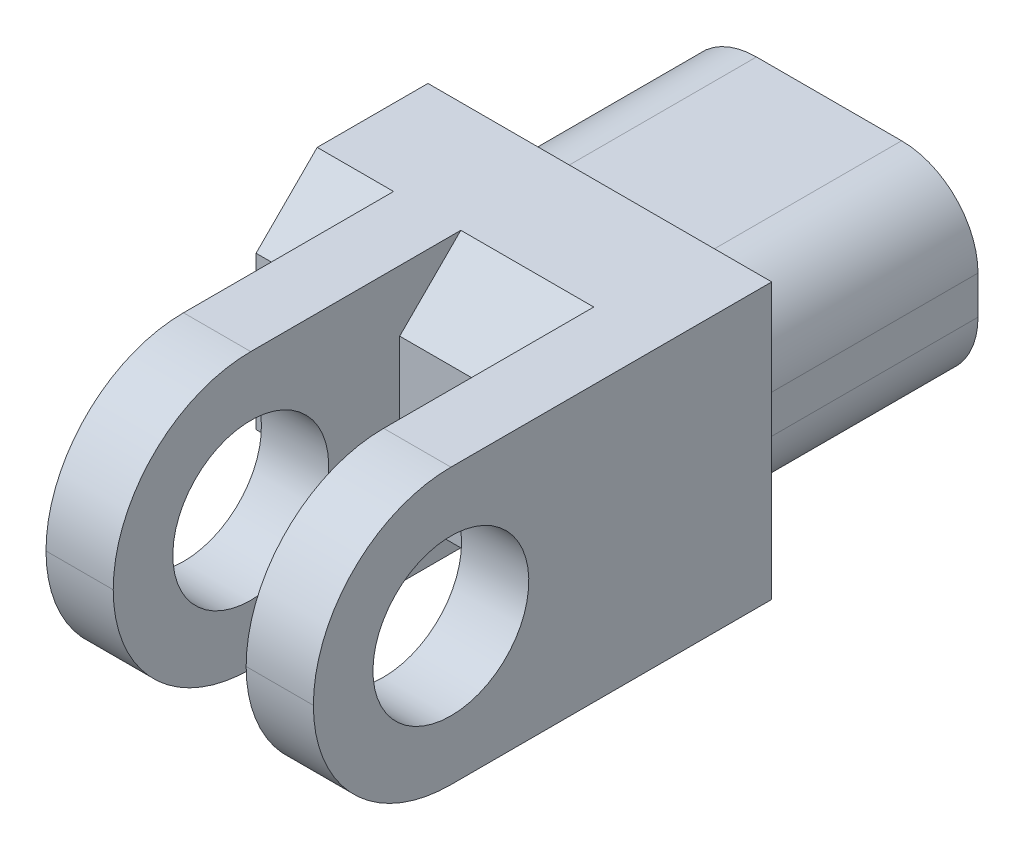
from build123d import *

# Parameters (mm, degrees)
SKETCH2_W           = 24.765
SKETCH2_H           = 15.875
BOSS_EXTRUDE1_DEPTH = 19.05
SKETCH3_W           = 28.575
SKETCH3_H           = 22.86
BOSS_EXTRUDE2_DEPTH = 38.1
SKETCH4_W           = 6.35
SKETCH4_H           = 23.8125
SKETCH4_W_2         = 11.049
CUT_EXTRUDE1_DEPTH  = 47.6725
FILLET5_R           = 11.43
SKETCH7_R           = 6.477
CUT_EXTRUDE3_DEPTH  = 46.56539833
FILLET3_R           = 6.35
CHAMFER1_SIZE       = 5.08


with BuildPart() as part:
    # Sketch2 → Boss-Extrude1 (new body)
    with BuildSketch(Plane.XY):
        Rectangle(SKETCH2_W, SKETCH2_H)
    extrude(amount=-BOSS_EXTRUDE1_DEPTH)

    # Sketch3 → Boss-Extrude2 (add)
    with BuildSketch(Plane.XY):
        Rectangle(SKETCH3_W, SKETCH3_H)
    extrude(amount=BOSS_EXTRUDE2_DEPTH)

    # Sketch4 → Cut-Extrude1 (cut, through all)
    with BuildSketch(Plane(origin=(0, -11.43, 0), x_dir=(-1, 0, 0), z_dir=(0, -1, 0))):
        with Locations((11.1125, -26.19375)):
            Rectangle(SKETCH4_W, SKETCH4_H)
        with Locations((-3.175, -26.19375)):
            Rectangle(SKETCH4_W_2, SKETCH4_H)
    extrude(amount=-CUT_EXTRUDE1_DEPTH, mode=Mode.SUBTRACT)

    # Fillet5
    fillet5_edges = [part.edges().sort_by_distance(p)[0] for p in [
        (-5.1435, -11.43, 38.1),
        (-5.1435, 11.43, 38.1),
        (11.4935, 11.43, 38.1),
        (11.4935, -11.43, 38.1),
    ]]
    fillet(fillet5_edges, radius=FILLET5_R - 0.0001)  # a hair under: the kernel refuses the full size

    # Sketch7 → Cut-Extrude3 (cut, through all)
    with BuildSketch(Plane.ZY.offset(7.9375)):
        with Locations(Location((26.67, 0, 0), (0, 0, 270))):
            Circle(SKETCH7_R)
    extrude(amount=-CUT_EXTRUDE3_DEPTH, mode=Mode.SUBTRACT)

    # Fillet3
    fillet3_edges = [part.edges().sort_by_distance(p)[0] for p in [
        (-12.3825, 7.9375, -9.525),
        (12.3825, 7.9375, -9.525),
        (12.3825, -7.9375, -9.525),
        (-12.3825, -7.9375, -9.525),
    ]]
    fillet(fillet3_edges, radius=FILLET3_R)

    # Chamfer1
    chamfer1_edges = [part.edges().sort_by_distance(p)[0] for p in [
        (-11.1125, 11.43, 14.2875),
        (-11.1125, -11.43, 14.2875),
        (3.175, 11.43, 14.2875),
        (3.175, -11.43, 14.2875),
    ]]
    chamfer(chamfer1_edges, length=CHAMFER1_SIZE)


solid = part.part
